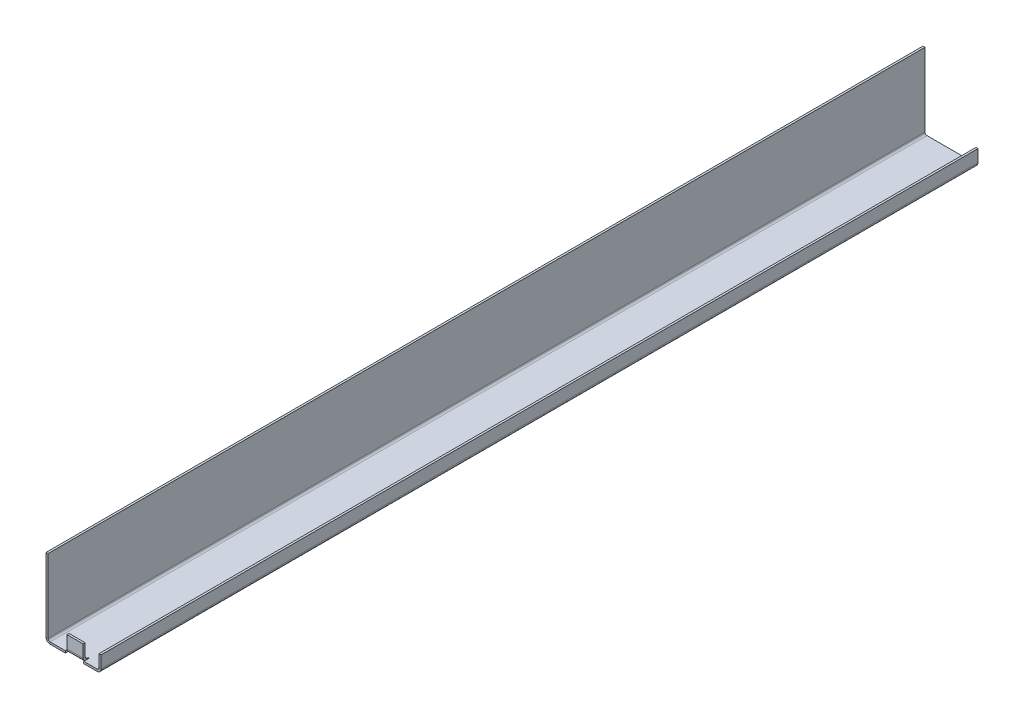
from build123d import *

# Parameters (mm, degrees)
BASE_FLANGE1_DEPTH            = 1365.25
EDGE_FLANGE1_STRIP_W          = 19.812
EDGE_FLANGE1_STRIP_H          = 3.175
EDGE_FLANGE1_STRIP_CUT_DEPTH  = 25.4
EDGE_FLANGE1_RELIEF_W         = 21.3995
EDGE_FLANGE1_RELIEF_H         = 1.5875
EDGE_FLANGE1_RELIEF_CUT_DEPTH = 3.175
EDGE_FLANGE1_DEPTH            = 25.4


# Sheet-metal steps are written as plain solids
with BuildPart() as part:
    # Sketch1 → Base-Flange1 (new body)
    with BuildSketch(Plane.XY):
        with BuildLine():
            Line((0, 120.65), (0, 6.35))
            ThreePointArc((0, 6.35), (1.859871939, 1.859871939), (6.35, 0))
            Line((6.35, 0), (79.375, 0))
            ThreePointArc((79.375, 0), (83.865128061, 1.859871939), (85.725, 6.35))
            Line((85.725, 6.35), (85.725, 25.4))
            Line((85.725, 25.4), (82.55, 25.4))
            Line((82.55, 25.4), (82.55, 6.35))
            ThreePointArc((82.55, 6.35), (81.62006403, 4.10493597), (79.375, 3.175))
            Line((79.375, 3.175), (6.35, 3.175))
            ThreePointArc((6.35, 3.175), (4.10493597, 4.10493597), (3.175, 6.35))
            Line((3.175, 6.35), (3.175, 120.65))
            Line((3.175, 120.65), (0, 120.65))
        make_face()
    extrude(amount=BASE_FLANGE1_DEPTH)

    # Edge-Flange1 strip (across the edge) → Edge-Flange1 strip cut (cut)
    with BuildSketch(Plane(origin=(31.75, 3.175, 1364.488), x_dir=(0, 0, -1), z_dir=(1, 0, 0))):
        with Locations((-3.556, -1.5875)):
            Rectangle(EDGE_FLANGE1_STRIP_W, EDGE_FLANGE1_STRIP_H)
    extrude(amount=EDGE_FLANGE1_STRIP_CUT_DEPTH, mode=Mode.SUBTRACT)

    # Edge-Flange1 relief (on the sheet) → Edge-Flange1 relief cut (cut)
    with BuildSketch(Plane(origin=(31.75, 3.175, 1358.138), x_dir=(0, 0, -1), z_dir=(0, 1, 0))):
        with Locations((-9.11225, 0.79375)):
            Rectangle(EDGE_FLANGE1_RELIEF_W, EDGE_FLANGE1_RELIEF_H)
        with Locations((-9.11225, -26.19375)):
            Rectangle(EDGE_FLANGE1_RELIEF_W, EDGE_FLANGE1_RELIEF_H)
    extrude(amount=-EDGE_FLANGE1_RELIEF_CUT_DEPTH, mode=Mode.SUBTRACT)

    # Edge-Flange1 section (across the edge) → Edge-Flange1 (add)
    with BuildSketch(Plane(origin=(31.75, 3.175, 1364.488), x_dir=(0, 0, -1), z_dir=(1, 0, 0))):
        with BuildLine():
            Line((0, 3.175), (0, 22.225))
            Line((0, 22.225), (3.175, 22.225))
            Line((3.175, 22.225), (3.175, 3.175))
            ThreePointArc((3.175, 3.175), (4.10493597, 0.92993597), (6.35, 0))
            Line((6.35, 0), (6.35, -3.175))
            ThreePointArc((6.35, -3.175), (1.859871939, -1.315128061), (0, 3.175))
        make_face()
    extrude(amount=EDGE_FLANGE1_DEPTH)


solid = part.part
